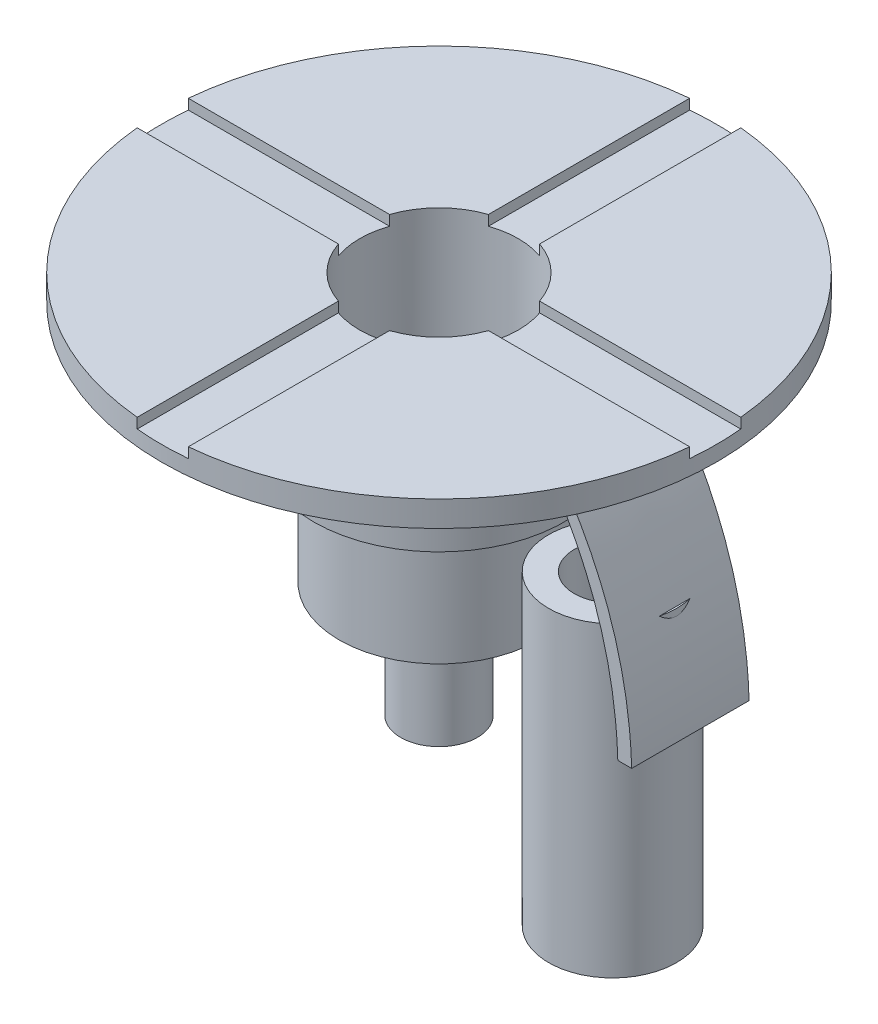
from build123d import *

# Parameters (mm, degrees)
SKETCH1_R                = 10.85
BOSS_EXTRUDE1_DEPTH      = 1
SKETCH2_R                = 4.9
BOSS_EXTRUDE2_DEPTH      = 5
SKETCH3_R                = 3.9
BOSS_EXTRUDE3_DEPTH      = 4.5
SKETCH4_R                = 1.5
BOSS_EXTRUDE4_DEPTH      = 4.5
CHAMFER1_SIZE            = 1
SKETCH5_R                = 3.1
CUT_EXTRUDE1_DEPTH       = 7.5
CUT_EXTRUDE_THIN2_START  = -0.4
SKETCH6_W                = 2
SKETCH6_H                = 21.149646587
CUT_EXTRUDE_THIN2_DEPTH  = 22.857982198
CIRPATTERN1_COUNT        = 4
SKETCH8_R                = 5.669003214
SKETCH8_R_2              = 4.883775851
BOSS_EXTRUDE5_DEPTH      = 1
SKETCH10_R               = 6.62346743
SKETCH10_R_2             = 4.788629078
BOSS_EXTRUDE6_DEPTH      = 0.1
SWEEP1_START             = -2.295822316
SWEEP1_DEPTH             = 4.591644632
EXTRUDE_THIN1_DEPTH      = 8
EXTRUDE_THIN1_DEPTH_BACK = 4
SKETCH13_R               = 2.5
SKETCH13_R_2             = 1.5


# Read off the part's stored shape, not the designer's step: Sweep1
with BuildPart() as part:
    # Sketch1 → Boss-Extrude1 (new body)
    with BuildSketch(Plane(origin=(0, 0, 0), x_dir=(1, 0, 0), z_dir=(0, 1, 0))):
        with Locations(Location((0, 0, 0), (0, 0, 270))):
            Circle(SKETCH1_R)
    extrude(amount=BOSS_EXTRUDE1_DEPTH)

    # Sketch2 → Boss-Extrude2 (add)
    with BuildSketch(Plane.XZ):
        with Locations(Location((0, 0, 0), (0, 0, 270))):
            Circle(SKETCH2_R)
    extrude(amount=BOSS_EXTRUDE2_DEPTH)

    # Sketch3 → Boss-Extrude3 (add)
    with BuildSketch(Plane.XZ.offset(5)):
        with Locations(Location((0, 0, 0), (0, 0, 270))):
            Circle(SKETCH3_R)
    extrude(amount=BOSS_EXTRUDE3_DEPTH)

    # Sketch4 → Boss-Extrude4 (add)
    with BuildSketch(Plane.XZ.offset(9.5)):
        with Locations(Location((0, 0, 0), (0, 0, 270))):
            Circle(SKETCH4_R)
    extrude(amount=BOSS_EXTRUDE4_DEPTH)

    # Chamfer1
    chamfer1_edges = [part.edges().sort_by_distance(p)[0] for p in [
        (0, 0, 4.9),
    ]]
    chamfer(chamfer1_edges, length=CHAMFER1_SIZE)

    # Sketch5 → Cut-Extrude1 (cut)
    with BuildSketch(Plane(origin=(0, 1, 0), x_dir=(1, 0, 0), z_dir=(0, 1, 0))):
        with Locations(Location((0, 0, 0), (0, 0, 270))):
            Circle(SKETCH5_R)
    extrude(amount=-CUT_EXTRUDE1_DEPTH, mode=Mode.SUBTRACT)

    # Sketch6 → Cut-Extrude-Thin2 (cut)
    with BuildSketch(Plane(origin=(0, 1, 0), x_dir=(1, 0, 0), z_dir=(0, 1, 0)).offset(CUT_EXTRUDE_THIN2_START)):
        with Locations((0, 10.574823294)):
            Rectangle(SKETCH6_W, SKETCH6_H)
    cut_extrude_thin2 = extrude(amount=CUT_EXTRUDE_THIN2_DEPTH, mode=Mode.SUBTRACT)

    # CirPattern1: Cut-Extrude-Thin2 ×4 about axis
    cirpattern1_axis = Axis((0, 0, 0), (0, 1, 0))
    for i in range(1, CIRPATTERN1_COUNT):
        add(cut_extrude_thin2.rotate(cirpattern1_axis, i * 360 / CIRPATTERN1_COUNT), mode=Mode.SUBTRACT)

    # Sketch8 → Boss-Extrude5 (add)
    with BuildSketch(Plane(origin=(0, -1, 0), x_dir=(-1, 0, 0), z_dir=(0, -1, 0))):
        with Locations(Location((0, 0, 0), (0, 0, 90))):
            Circle(SKETCH8_R)
        Circle(SKETCH8_R_2, mode=Mode.SUBTRACT)
    extrude(amount=BOSS_EXTRUDE5_DEPTH)



with BuildPart() as body_2:
    # Sketch10 → Boss-Extrude6 (new body)
    with BuildSketch(Plane(origin=(0, -1, 0), x_dir=(1, 0, 0), z_dir=(0, 1, 0))):
        with Locations(Location((0, 0, 0), (0, 0, 270))):
            Circle(SKETCH10_R)
        with Locations(Location((0, 0, 0), (0, 0, 270))):
            Circle(SKETCH10_R_2, mode=Mode.SUBTRACT)
    extrude(amount=BOSS_EXTRUDE6_DEPTH)

    # Sweep1 outline → Sweep1 (add)
    with BuildSketch(Plane.XY.offset(SWEEP1_START)):
        with BuildLine():
            Line((6.894755274, -1), (6.352179586, -1))
            add(Edge.make_bspline(
                [(6.352179586, -1), (8.215144945, -3.590953031), (9.19411107, -6.50188171), (9.289077959, -9.732786039)],
                knots=[0, 0, 0, 0, 1, 1, 1, 1], degree=3))
            Line((9.289077959, -9.732786039), (9.831653647, -9.732786039))
            add(Edge.make_bspline(
                [(6.894755274, -1), (8.757720633, -3.590953031), (9.736686757, -6.50188171), (9.831653647, -9.732786039)],
                knots=[0, 0, 0, 0, 1, 1, 1, 1], degree=3))
        make_face()
    extrude(amount=SWEEP1_DEPTH)


with BuildPart() as part_1:
    add(part.part)

    add(body_2.part)  # Extrude-Thin1 merges body 2
    # Sketch13 → Extrude-Thin1 (add, two sides: drawn at the far end of the back side and taken through both)
    with BuildSketch(Plane.XZ.offset(9.732786039).offset(-EXTRUDE_THIN1_DEPTH_BACK)):
        with Locations((6.789077959, 0)):
            Circle(SKETCH13_R)
        with Locations((6.789077959, 0)):
            Circle(SKETCH13_R_2, mode=Mode.SUBTRACT)
    extrude(amount=EXTRUDE_THIN1_DEPTH + EXTRUDE_THIN1_DEPTH_BACK)


solid = part_1.part
